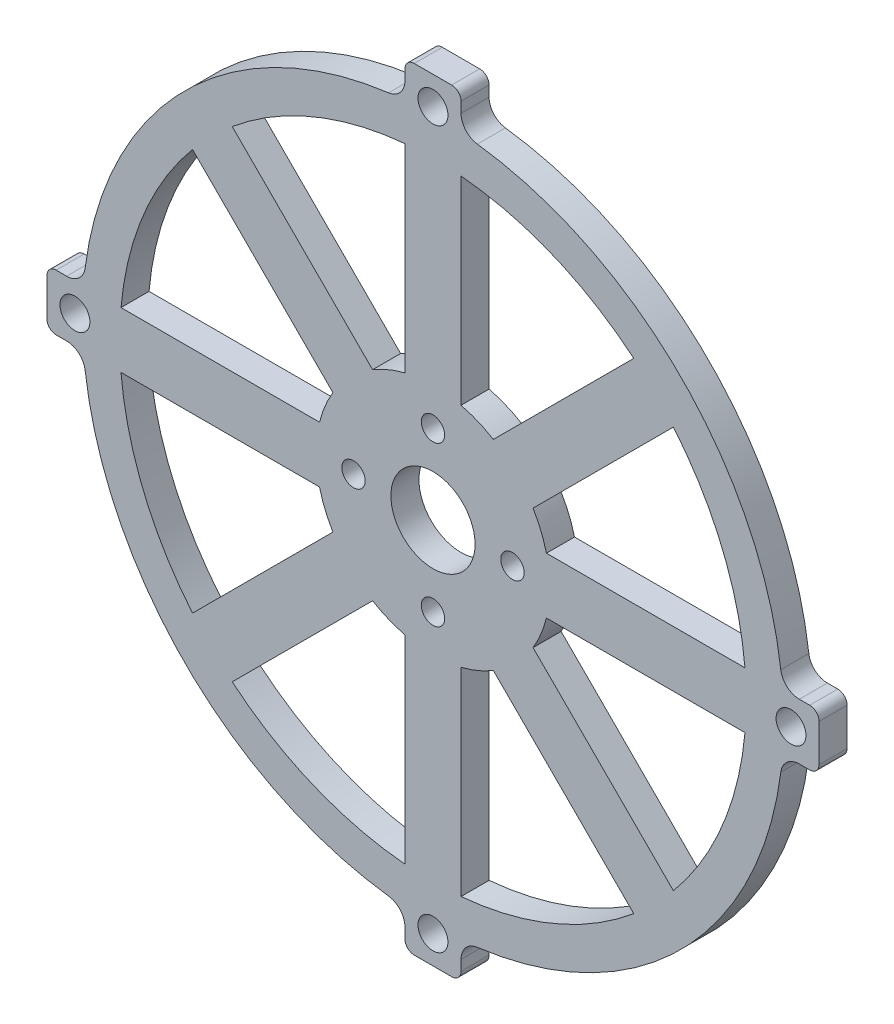
from build123d import *

# Parameters (mm, degrees)
SKETCH_1_R          = 1.6
EXTRUDE_1_DEPTH     = 3
SKETCH_3_R          = 4.5
SKETCH_3_R_2        = 1.25
CUT_EXTRUDE_1_DEPTH = 59.472213298
CUT_EXTRUDE_2_DEPTH = 59.472213298
FILLET_1_R          = 1


with BuildPart() as part:
    # ｽｹｯﾁ1 → ﾎﾞｽ - 押し出し1 (new body)
    with BuildSketch(Plane.XY):
        with BuildLine():
            Line((-3, -39.182266397), (-3, -41.291643997))
            Line((-3, -41.291643997), (3, -41.291643997))
            Line((3, -41.291643997), (3, -39.182266397))
            ThreePointArc((3, -39.182266397), (3.498945518, -37.860587373), (4.746835443, -37.198354174))
            ThreePointArc((4.746835443, -37.198354174), (26.516504294, -26.516504294), (37.198354174, -4.746835443))
            ThreePointArc((37.198354174, -4.746835443), (37.860587373, -3.498945518), (39.182266397, -3))
            Line((39.182266397, -3), (41.291643997, -3))
            Line((41.291643997, -3), (41.291643997, 3))
            Line((41.291643997, 3), (39.182266397, 3))
            ThreePointArc((39.182266397, 3), (37.860587373, 3.498945518), (37.198354174, 4.746835443))
            ThreePointArc((37.198354174, 4.746835443), (26.516504294, 26.516504294), (4.746835443, 37.198354174))
            ThreePointArc((4.746835443, 37.198354174), (3.498945518, 37.860587373), (3, 39.182266397))
            Line((3, 39.182266397), (3, 41.291643997))
            Line((3, 41.291643997), (-3, 41.291643997))
            Line((-3, 41.291643997), (-3, 39.182266397))
            ThreePointArc((-3, 39.182266397), (-3.498945518, 37.860587373), (-4.746835443, 37.198354174))
            ThreePointArc((-4.746835443, 37.198354174), (-26.516504294, 26.516504294), (-37.198354174, 4.746835443))
            ThreePointArc((-37.198354174, 4.746835443), (-37.860587373, 3.498945518), (-39.182266397, 3))
            Line((-39.182266397, 3), (-41.291643997, 3))
            Line((-41.291643997, 3), (-41.291643997, -3))
            Line((-41.291643997, -3), (-39.182266397, -3))
            ThreePointArc((-39.182266397, -3), (-37.860587373, -3.498945518), (-37.198354174, -4.746835443))
            ThreePointArc((-37.198354174, -4.746835443), (-26.516504294, -26.516504294), (-4.746835443, -37.198354174))
            ThreePointArc((-4.746835443, -37.198354174), (-3.498945518, -37.860587373), (-3, -39.182266397))
        make_face()
        with Locations((-38.291643997, 0)):
            Circle(SKETCH_1_R, mode=Mode.SUBTRACT)
        with Locations((0, -38.291643997)):
            Circle(SKETCH_1_R, mode=Mode.SUBTRACT)
        with Locations((0, 38.291643997)):
            Circle(SKETCH_1_R, mode=Mode.SUBTRACT)
        with Locations((38.291643997, 0)):
            Circle(SKETCH_1_R, mode=Mode.SUBTRACT)
    extrude(amount=EXTRUDE_1_DEPTH)

    # ｽｹｯﾁ3 → ｶｯﾄ - 押し出し1 (cut, through all)
    with BuildSketch(Plane.XY.offset(3)):
        Circle(SKETCH_3_R)
        with Locations((0, 8.5)):
            Circle(SKETCH_3_R_2)
        with Locations((8.5, 0)):
            Circle(SKETCH_3_R_2)
        with Locations((0, -8.5)):
            Circle(SKETCH_3_R_2)
        with Locations((-8.5, 0)):
            Circle(SKETCH_3_R_2)
    extrude(amount=-CUT_EXTRUDE_1_DEPTH, mode=Mode.SUBTRACT)

    # ｽｹｯﾁ4 → ｶｯﾄ - 押し出し2 (cut, through all)
    with BuildSketch(Plane.XY.offset(3)):
        with BuildLine():
            Line((-3, 33.365401241), (-3, 12.1346611))
            ThreePointArc((-3, 12.1346611), (-4.783542905, 11.548494156), (-6.459180807, 10.701821494))
            Line((-6.459180807, 10.701821494), (-21.471581131, 25.714221818))
            ThreePointArc((-21.471581131, 25.714221818), (-12.819894984, 30.949964339), (-3, 33.365401241))
        make_face()
        with BuildLine():
            Line((3, 33.365401241), (3, 12.1346611))
            ThreePointArc((3, 12.1346611), (4.783542905, 11.548494156), (6.459180807, 10.701821494))
            Line((6.459180807, 10.701821494), (21.471581131, 25.714221818))
            ThreePointArc((21.471581131, 25.714221818), (12.819894984, 30.949964339), (3, 33.365401241))
        make_face()
        with BuildLine():
            Line((33.365401241, 3), (12.1346611, 3))
            ThreePointArc((12.1346611, 3), (11.548494156, 4.783542905), (10.701821494, 6.459180807))
            Line((10.701821494, 6.459180807), (25.714221818, 21.471581131))
            ThreePointArc((25.714221818, 21.471581131), (30.949964339, 12.819894984), (33.365401241, 3))
        make_face()
        with BuildLine():
            Line((33.365401241, -3), (12.1346611, -3))
            ThreePointArc((12.1346611, -3), (11.548494156, -4.783542905), (10.701821494, -6.459180807))
            Line((10.701821494, -6.459180807), (25.714221818, -21.471581131))
            ThreePointArc((25.714221818, -21.471581131), (30.949964339, -12.819894984), (33.365401241, -3))
        make_face()
        with BuildLine():
            Line((3, -33.365401241), (3, -12.1346611))
            ThreePointArc((3, -12.1346611), (4.783542905, -11.548494156), (6.459180807, -10.701821494))
            Line((6.459180807, -10.701821494), (21.471581131, -25.714221818))
            ThreePointArc((21.471581131, -25.714221818), (12.819894984, -30.949964339), (3, -33.365401241))
        make_face()
        with BuildLine():
            Line((-3, -33.365401241), (-3, -12.1346611))
            ThreePointArc((-3, -12.1346611), (-4.783542905, -11.548494156), (-6.459180807, -10.701821494))
            Line((-6.459180807, -10.701821494), (-21.471581131, -25.714221818))
            ThreePointArc((-21.471581131, -25.714221818), (-12.819894984, -30.949964339), (-3, -33.365401241))
        make_face()
        with BuildLine():
            Line((-33.365401241, -3), (-12.1346611, -3))
            ThreePointArc((-12.1346611, -3), (-11.548494156, -4.783542905), (-10.701821494, -6.459180807))
            Line((-10.701821494, -6.459180807), (-25.714221818, -21.471581131))
            ThreePointArc((-25.714221818, -21.471581131), (-30.949964339, -12.819894984), (-33.365401241, -3))
        make_face()
        with BuildLine():
            Line((-33.365401241, 3), (-12.1346611, 3))
            ThreePointArc((-12.1346611, 3), (-11.548494156, 4.783542905), (-10.701821494, 6.459180807))
            Line((-10.701821494, 6.459180807), (-25.714221818, 21.471581131))
            ThreePointArc((-25.714221818, 21.471581131), (-30.949964339, 12.819894984), (-33.365401241, 3))
        make_face()
    extrude(amount=-CUT_EXTRUDE_2_DEPTH, mode=Mode.SUBTRACT)

    # ﾌｨﾚｯﾄ1
    fillet_1_edges = [part.edges().sort_by_distance(p)[0] for p in [
        (41.291643997, 3, 1.5),
        (41.291643997, -3, 1.5),
        (3, -41.291643997, 1.5),
        (-3, -41.291643997, 1.5),
        (-41.291643997, -3, 1.5),
        (-41.291643997, 3, 1.5),
        (-3, 41.291643997, 1.5),
        (3, 41.291643997, 1.5),
    ]]
    fillet(fillet_1_edges, radius=FILLET_1_R)


solid = part.part
